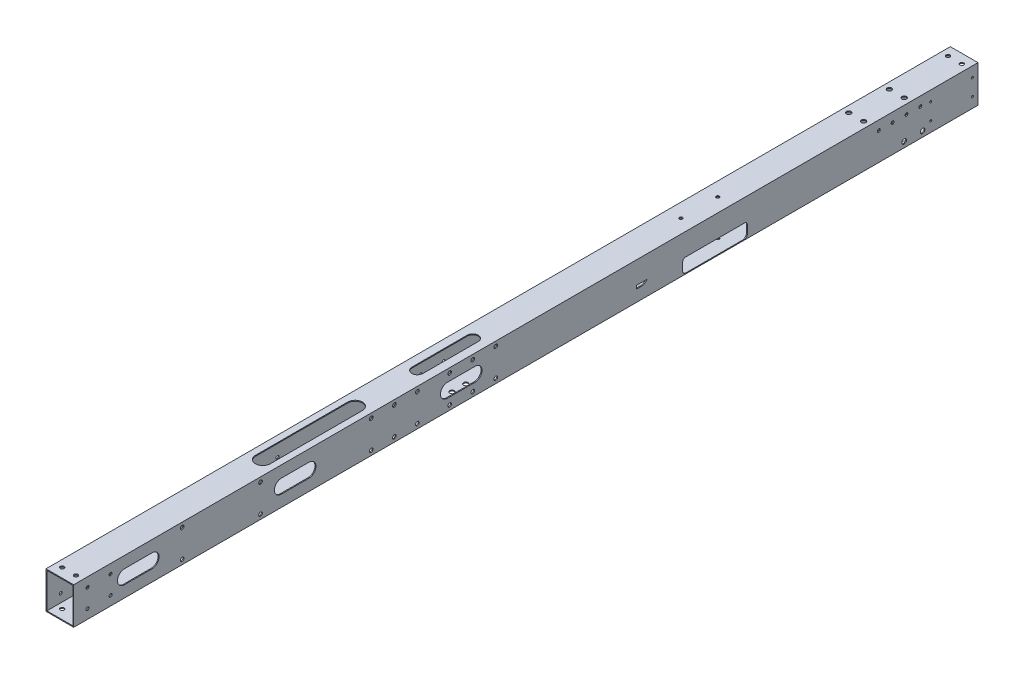
from build123d import *

# Parameters (mm, degrees)
SKETCH_1_W             = 30
SKETCH_1_H             = 40
SKETCH_1_W_2           = 28
SKETCH_1_H_2           = 38
EXTRUDE_1_DEPTH        = 940
SKETCH_5_R             = 2.5
CUT_EXTRUDE_3_DEPTH    = 941.97024395
CUT_EXTRUDE_4_DEPTH    = 1
SKETCH_7_R             = 1.75
CUT_EXTRUDE_5_DEPTH    = 1
SKETCH_17_W            = 30
SKETCH_17_H            = 40
SKETCH_17_W_2          = 28
SKETCH_17_H_2          = 38
EXTRUDE_2_DEPTH        = 20
SKETCH_18_W            = 30
SKETCH_18_H            = 40
SKETCH_18_W_2          = 28
SKETCH_18_H_2          = 38
EXTRUDE_3_DEPTH        = 20
SKETCH_19_R            = 2.1
CUT_EXTRUDE_16_DEPTH   = 961.950050731
SKETCH_20_R            = 1.6
CUT_EXTRUDE_17_DEPTH   = 961.67684473
SKETCH_21_R            = 2.5
SKETCH_21_R_2          = 1.6
CUT_EXTRUDE_18_DEPTH   = 961.67684473
SKETCH_23_R            = 2.5
CUT_EXTRUDE_19_DEPTH   = 961.950050731
SKETCH_24_R            = 4.5
CUT_EXTRUDE_20_DEPTH   = 10
SKETCH_26_R            = 2
CUT_EXTRUDE_22_DEPTH   = 961.67684473
CUT_EXTRUDE_28_DEPTH   = 10
PATTERN_LINEAR_4_COUNT = 2
PATTERN_LINEAR_4_PITCH = 255
PATTERN_LINEAR_8_COUNT = 2
PATTERN_LINEAR_8_PITCH = 205
PATTERN_LINEAR_9_COUNT = 2
PATTERN_LINEAR_9_PITCH = 230
CUT_EXTRUDE_START      = -20
SKETCH_34_R            = 1.75
CUT_EXTRUDE_29_DEPTH   = 20
SKETCH_35_R            = 1.5
CUT_EXTRUDE_30_DEPTH   = 10
CUT_EXTRUDE_31_DEPTH   = 10
SKETCH_37_R            = 1.65
CUT_EXTRUDE_32_DEPTH   = 52
SKETCH_39_R            = 1.75
CUT_EXTRUDE_33_DEPTH   = 10
SKETCH_40_W            = 70
SKETCH_40_H            = 15
CUT_EXTRUDE_34_DEPTH   = 10
EXTRUDE_5_DEPTH        = 1
SKETCH_43_W            = 38.522995696
SKETCH_43_H            = 13.00002022
EXTRUDE_6_DEPTH        = 1
FILLET_1_R             = 3
CUT_EXTRUDE_35_DEPTH   = 10
SKETCH_45_R            = 1.1
CUT_EXTRUDE_36_DEPTH   = 1


with BuildPart() as part:
    # 草图1 → 凸台-拉伸1 (new body)
    with BuildSketch(Plane.XY):
        Rectangle(SKETCH_1_W, SKETCH_1_H)
        Rectangle(SKETCH_1_W_2, SKETCH_1_H_2, mode=Mode.SUBTRACT)
    extrude(amount=EXTRUDE_1_DEPTH)

    # 草图5 → 切除-拉伸3 (cut, through all)
    with BuildSketch(Plane.XZ.offset(20)):
        with Locations((-8, 53)):
            Circle(SKETCH_5_R)
        with Locations((8, 53)):
            Circle(SKETCH_5_R)
        with Locations((-8, 97)):
            Circle(SKETCH_5_R)
        with Locations((8, 97)):
            Circle(SKETCH_5_R)
    extrude(amount=-CUT_EXTRUDE_3_DEPTH, mode=Mode.SUBTRACT)

    # 草图6 → 切除-拉伸4 (cut)
    with BuildSketch(Plane(origin=(15, 0, 0), x_dir=(0, 0, -1), z_dir=(1, 0, 0))):
        with BuildLine():
            Line((-345, -7.5), (-375, -7.5))
            ThreePointArc((-375, -7.5), (-382.5, 0), (-375, 7.5))
            Line((-375, 7.5), (-345, 7.5))
            ThreePointArc((-345, 7.5), (-337.5, 0), (-345, -7.5))
        make_face()
        with BuildLine():
            Line((-525, -7.5), (-555, -7.5))
            ThreePointArc((-555, -7.5), (-562.5, 0), (-555, 7.5))
            Line((-555, 7.5), (-525, 7.5))
            ThreePointArc((-525, 7.5), (-517.5, 0), (-525, -7.5))
        make_face()
        with BuildLine():
            Line((-705, -7.5), (-735, -7.5))
            ThreePointArc((-735, -7.5), (-742.5, 0), (-735, 7.5))
            Line((-735, 7.5), (-705, 7.5))
            ThreePointArc((-705, 7.5), (-697.5, 0), (-705, -7.5))
        make_face()
    extrude(amount=-CUT_EXTRUDE_4_DEPTH, mode=Mode.SUBTRACT)

    # 草图7 → 切除-拉伸5 (cut)
    with BuildSketch(Plane.ZY.offset(15)):
        with Locations((350, 0)):
            Circle(SKETCH_7_R)
        with Locations((375, 0)):
            Circle(SKETCH_7_R)
        with Locations((530, 0)):
            Circle(SKETCH_7_R)
        with Locations((555, 0)):
            Circle(SKETCH_7_R)
        with Locations((710, 0)):
            Circle(SKETCH_7_R)
        with Locations((735, 0)):
            Circle(SKETCH_7_R)
    extrude(amount=-CUT_EXTRUDE_5_DEPTH, mode=Mode.SUBTRACT)

    # 草图17 → 凸台-拉伸2 (add)
    with BuildSketch(Plane.XY.offset(940)):
        Rectangle(SKETCH_17_W, SKETCH_17_H)
        Rectangle(SKETCH_17_W_2, SKETCH_17_H_2, mode=Mode.SUBTRACT)
    extrude(amount=EXTRUDE_2_DEPTH)

    # 草图18 → 凸台-拉伸3 (add)
    with BuildSketch(Plane(origin=(0, 0, 0), x_dir=(-1, 0, 0), z_dir=(0, 0, -1))):
        Rectangle(SKETCH_18_W, SKETCH_18_H)
        Rectangle(SKETCH_18_W_2, SKETCH_18_H_2, mode=Mode.SUBTRACT)
    extrude(amount=EXTRUDE_3_DEPTH)

    # 草图19 → 切除-拉伸16 (cut, through all)
    with BuildSketch(Plane(origin=(0, 20, 0), x_dir=(1, 0, 0), z_dir=(0, 1, 0))):
        with Locations((-7.5, -950)):
            Circle(SKETCH_19_R)
        with Locations((7.5, -950)):
            Circle(SKETCH_19_R)
        with Locations((-7.5, 10)):
            Circle(SKETCH_19_R)
        with Locations((7.5, 10)):
            Circle(SKETCH_19_R)
    extrude(amount=-CUT_EXTRUDE_16_DEPTH, mode=Mode.SUBTRACT)

    # 草图20 → 切除-拉伸17 (cut, through all)
    with BuildSketch(Plane(origin=(15, 0, 0), x_dir=(0, 0, -1), z_dir=(1, 0, 0))):
        with Locations((-945, 10)):
            Circle(SKETCH_20_R)
        with Locations((-920, 10)):
            Circle(SKETCH_20_R)
        with Locations((-920, -10)):
            Circle(SKETCH_20_R)
        with Locations((-945, -10)):
            Circle(SKETCH_20_R)
    extrude(amount=-CUT_EXTRUDE_17_DEPTH, mode=Mode.SUBTRACT)

    # 草图21 → 切除-拉伸18 (cut, through all)
    with BuildSketch(Plane(origin=(15, 0, 0), x_dir=(0, 0, -1), z_dir=(1, 0, 0))):
        with Locations((-40, -14)):
            Circle(SKETCH_21_R)
        with Locations((-60, -14)):
            Circle(SKETCH_21_R)
        with Locations((-42.5, 10)):
            Circle(SKETCH_21_R_2)
        with Locations((-57.5, 10)):
            Circle(SKETCH_21_R_2)
        with Locations((-72.5, 10)):
            Circle(SKETCH_21_R_2)
        with Locations((-87.5, 10)):
            Circle(SKETCH_21_R_2)
    extrude(amount=-CUT_EXTRUDE_18_DEPTH, mode=Mode.SUBTRACT)

    # 草图23 → 切除-拉伸19 (cut, through all)
    with BuildSketch(Plane(origin=(0, 20, 0), x_dir=(1, 0, 0), z_dir=(0, 1, 0))):
        with Locations((0, -520)):
            Circle(SKETCH_23_R)
        with Locations((0, -535)):
            Circle(SKETCH_23_R)
        with Locations((0, -550)):
            Circle(SKETCH_23_R)
        with Locations((0, -565)):
            Circle(SKETCH_23_R)
    extrude(amount=-CUT_EXTRUDE_19_DEPTH, mode=Mode.SUBTRACT)

    # 草图24 → 切除-拉伸20 (cut)
    with BuildSketch(Plane(origin=(0, 20, 0), x_dir=(1, 0, 0), z_dir=(0, 1, 0))):
        with Locations((0, -520)):
            Circle(SKETCH_24_R)
        with Locations((0, -535)):
            Circle(SKETCH_24_R)
        with Locations((0, -550)):
            Circle(SKETCH_24_R)
        with Locations((0, -565)):
            Circle(SKETCH_24_R)
    extrude(amount=-CUT_EXTRUDE_20_DEPTH, mode=Mode.SUBTRACT)

    # 草图26 → 切除-拉伸22 (cut, through all)
    with BuildSketch(Plane(origin=(15, 0, 0), x_dir=(0, 0, -1), z_dir=(1, 0, 0))):
        with Locations((-842.5, 15)):
            Circle(SKETCH_26_R)
        with Locations((-842.5, -15)):
            Circle(SKETCH_26_R)
        with Locations((-757.5, -15)):
            Circle(SKETCH_26_R)
        with Locations((-757.5, 15)):
            Circle(SKETCH_26_R)
    cut_extrude_22 = extrude(amount=-CUT_EXTRUDE_22_DEPTH, mode=Mode.SUBTRACT)

    # 草图33 → 切除-拉伸28 (cut)
    with BuildSketch(Plane(origin=(0, 20, 0), x_dir=(1, 0, 0), z_dir=(0, 1, 0))):
        with BuildLine():
            Line((6, -512.5), (6, -572.5))
            ThreePointArc((6, -572.5), (0, -578.5), (-6, -572.5))
            Line((-6, -572.5), (-6, -512.5))
            ThreePointArc((-6, -512.5), (0, -506.5), (6, -512.5))
        make_face()
    extrude(amount=-CUT_EXTRUDE_28_DEPTH, mode=Mode.SUBTRACT)

    # 阵列(线性)4: 切除-拉伸22 ×2
    with Locations(*[(0, 0, -i * PATTERN_LINEAR_4_PITCH) for i in range(1, PATTERN_LINEAR_4_COUNT)]):
        add(cut_extrude_22, mode=Mode.SUBTRACT)

    # 阵列(线性)8: 切除-拉伸22 ×2
    with Locations(*[(0, 0, -i * PATTERN_LINEAR_8_PITCH) for i in range(1, PATTERN_LINEAR_8_COUNT)]):
        add(cut_extrude_22, mode=Mode.SUBTRACT)

    # 阵列(线性)9: 切除-拉伸22 ×2
    with Locations(*[(0, 0, -i * PATTERN_LINEAR_9_PITCH) for i in range(1, PATTERN_LINEAR_9_COUNT)]):
        add(cut_extrude_22, mode=Mode.SUBTRACT)

    # 草图34 → 切除-拉伸29 (cut)
    with BuildSketch(Plane(origin=(15, 0, 0), x_dir=(0, 0, -1), z_dir=(1, 0, 0)).offset(CUT_EXTRUDE_START)):
        with Locations((-905, 0)):
            Circle(SKETCH_34_R)
        with Locations((-880, 0)):
            Circle(SKETCH_34_R)
    extrude(amount=-CUT_EXTRUDE_29_DEPTH, mode=Mode.SUBTRACT)

    # 草图35 → 切除-拉伸30 (cut)
    with BuildSketch(Plane.XZ.offset(20)):
        with Locations((5, 720)):
            Circle(SKETCH_35_R)
        with Locations((5, 700)):
            Circle(SKETCH_35_R)
        with Locations((5, 680)):
            Circle(SKETCH_35_R)
        with Locations((5, 660)):
            Circle(SKETCH_35_R)
        with Locations((5, 640)):
            Circle(SKETCH_35_R)
        with Locations((5, 740)):
            Circle(SKETCH_35_R)
    extrude(amount=-CUT_EXTRUDE_30_DEPTH, mode=Mode.SUBTRACT)

    # 草图36 → 切除-拉伸31 (cut)
    with BuildSketch(Plane(origin=(0, 20, 0), x_dir=(1, 0, 0), z_dir=(0, 1, 0))):
        with BuildLine():
            Line((8, -640), (8, -740))
            ThreePointArc((8, -740), (0, -748), (-8, -740))
            Line((-8, -740), (-8, -640))
            ThreePointArc((-8, -640), (0, -632), (8, -640))
        make_face()
    extrude(amount=-CUT_EXTRUDE_31_DEPTH, mode=Mode.SUBTRACT)

    # 草图37 → 切除-拉伸32 (cut)
    with BuildSketch(Plane(origin=(0, 20, 0), x_dir=(1, 0, 0), z_dir=(0, 1, 0))):
        with Locations((0, -247)):
            Circle(SKETCH_37_R)
        with Locations((0, -287)):
            Circle(SKETCH_37_R)
    extrude(amount=-CUT_EXTRUDE_32_DEPTH, mode=Mode.SUBTRACT)

    # 草图39 → 切除-拉伸33 (cut)
    with BuildSketch(Plane.XZ.offset(20)):
        with Locations((0, 137)):
            Circle(SKETCH_39_R)
        with Locations((0, 177)):
            Circle(SKETCH_39_R)
    extrude(amount=-CUT_EXTRUDE_33_DEPTH, mode=Mode.SUBTRACT)

    # 草图40 → 切除-拉伸34 (cut)
    with BuildSketch(Plane(origin=(15, 0, 0), x_dir=(0, 0, -1), z_dir=(1, 0, 0))):
        with Locations((-265, -11.5)):
            Rectangle(SKETCH_40_W, SKETCH_40_H)
    extrude(amount=-CUT_EXTRUDE_34_DEPTH, mode=Mode.SUBTRACT)

    # 草图42 → 凸台-拉伸5 (add)
    with BuildSketch(Plane(origin=(15, 0, 0), x_dir=(0, 0, -1), z_dir=(1, 0, 0))):
        Polygon((-350, -8.24794841), (-350, -4), (-334.23295051, -4), (-334.23295051, 12.222841732), (-383.610977641, 12.222841732), (-383.610977641, -8.24794841), align=None)
    extrude(amount=-EXTRUDE_5_DEPTH)

    # 草图43 → 凸台-拉伸6 (add)
    with BuildSketch(Plane.ZY.offset(15)):
        with Locations((362.400416305, 1.435266839)):
            Rectangle(SKETCH_43_W, SKETCH_43_H)
    extrude(amount=-EXTRUDE_6_DEPTH)

    # 圆角1
    fillet_1_edges = [part.edges().sort_by_distance(p)[0] for p in [
        (14.5, -19, 230),
        (14.5, -4, 230),
        (14.5, -19, 300),
        (14.5, -4, 300),
    ]]
    fillet(fillet_1_edges, radius=FILLET_1_R)

    # 草图44 → 切除-拉伸35 (cut)
    with BuildSketch(Plane(origin=(15, 0, 0), x_dir=(0, 0, -1), z_dir=(1, 0, 0))):
        with BuildLine():
            ThreePointArc((-875, -7.5), (-867.5, 0), (-875, 7.5))
            Line((-875, 7.5), (-905, 7.5))
            ThreePointArc((-905, 7.5), (-912.5, 0), (-905, -7.5))
            Line((-905, -7.5), (-875, -7.5))
        make_face()
    extrude(amount=-CUT_EXTRUDE_35_DEPTH, mode=Mode.SUBTRACT)

    # 草图45 → 切除-拉伸36 (cut)
    with BuildSketch(Plane(origin=(15, 0, 0), x_dir=(0, 0, -1), z_dir=(1, 0, 0))):
        with Locations((-31.199995376, 9.020444537)):
            Circle(SKETCH_45_R)
        with Locations((14, 9)):
            Circle(SKETCH_45_R)
        with Locations((14, -9)):
            Circle(SKETCH_45_R)
        with Locations((-31.199995376, -9.020444537)):
            Circle(SKETCH_45_R)
    extrude(amount=-CUT_EXTRUDE_36_DEPTH, mode=Mode.SUBTRACT)


solid = part.part
